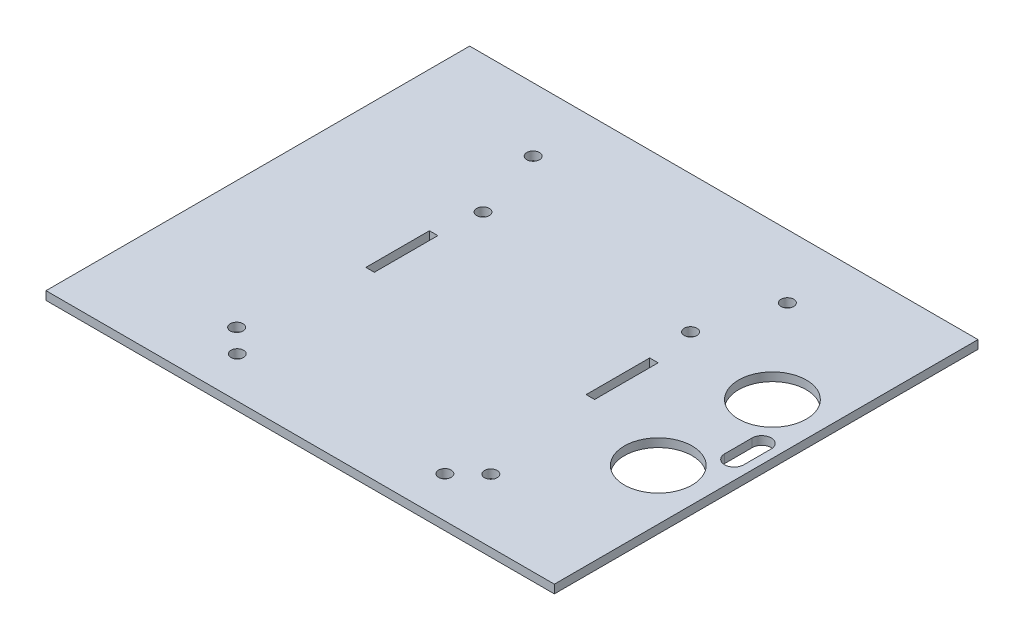
from build123d import *

# Parameters (mm, degrees)
SKETCH_1_W          = 120
SKETCH_1_H          = 100
SKETCH_1_R          = 1.5
SKETCH_1_W_2        = 2
SKETCH_1_H_2        = 15
EXTRUDE_1_DEPTH     = 2
SKETCH_2_R          = 8
CUT_EXTRUDE_1_DEPTH = 79.128099938


with BuildPart() as part:
    # 草圖1 → 填料-伸長1 (new body)
    with BuildSketch(Plane(origin=(0, 0, 0), x_dir=(1, 0, 0), z_dir=(0, 1, 0))):
        Rectangle(SKETCH_1_W, SKETCH_1_H)
        with Locations((-30, 35)):
            Circle(SKETCH_1_R, mode=Mode.SUBTRACT)
        with Locations((30, 35)):
            Circle(SKETCH_1_R, mode=Mode.SUBTRACT)
        with Locations((30, -35)):
            Circle(SKETCH_1_R, mode=Mode.SUBTRACT)
        with Locations((-30, -35)):
            Circle(SKETCH_1_R, mode=Mode.SUBTRACT)
        with Locations((24.5, 17.65)):
            Circle(SKETCH_1_R, mode=Mode.SUBTRACT)
        with Locations((24.5, -40.35)):
            Circle(SKETCH_1_R, mode=Mode.SUBTRACT)
        with Locations((-24.5, 17.65)):
            Circle(SKETCH_1_R, mode=Mode.SUBTRACT)
        with Locations((-24.5, -40.35)):
            Circle(SKETCH_1_R, mode=Mode.SUBTRACT)
        with Locations((-26, 0)):
            Rectangle(SKETCH_1_W_2, SKETCH_1_H_2, mode=Mode.SUBTRACT)
        with Locations((26, 0)):
            Rectangle(SKETCH_1_W_2, SKETCH_1_H_2, mode=Mode.SUBTRACT)
    extrude(amount=EXTRUDE_1_DEPTH)

    # 草圖2 → 除料-伸長1 (cut, through all)
    with BuildSketch(Plane(origin=(0, 2, 0), x_dir=(1, 0, 0), z_dir=(0, 1, 0))):
        with Locations((48, 13.48)):
            Circle(SKETCH_2_R)
        with Locations((48, -13.48)):
            Circle(SKETCH_2_R)
        with BuildLine():
            Line((53.45, -3.25), (53.45, 3.25))
            ThreePointArc((53.45, 3.25), (55.7, 5.5), (57.95, 3.25))
            Line((57.95, 3.25), (57.95, -3.25))
            ThreePointArc((57.95, -3.25), (55.7, -5.5), (53.45, -3.25))
        make_face()
    extrude(amount=-CUT_EXTRUDE_1_DEPTH, mode=Mode.SUBTRACT)


solid = part.part
